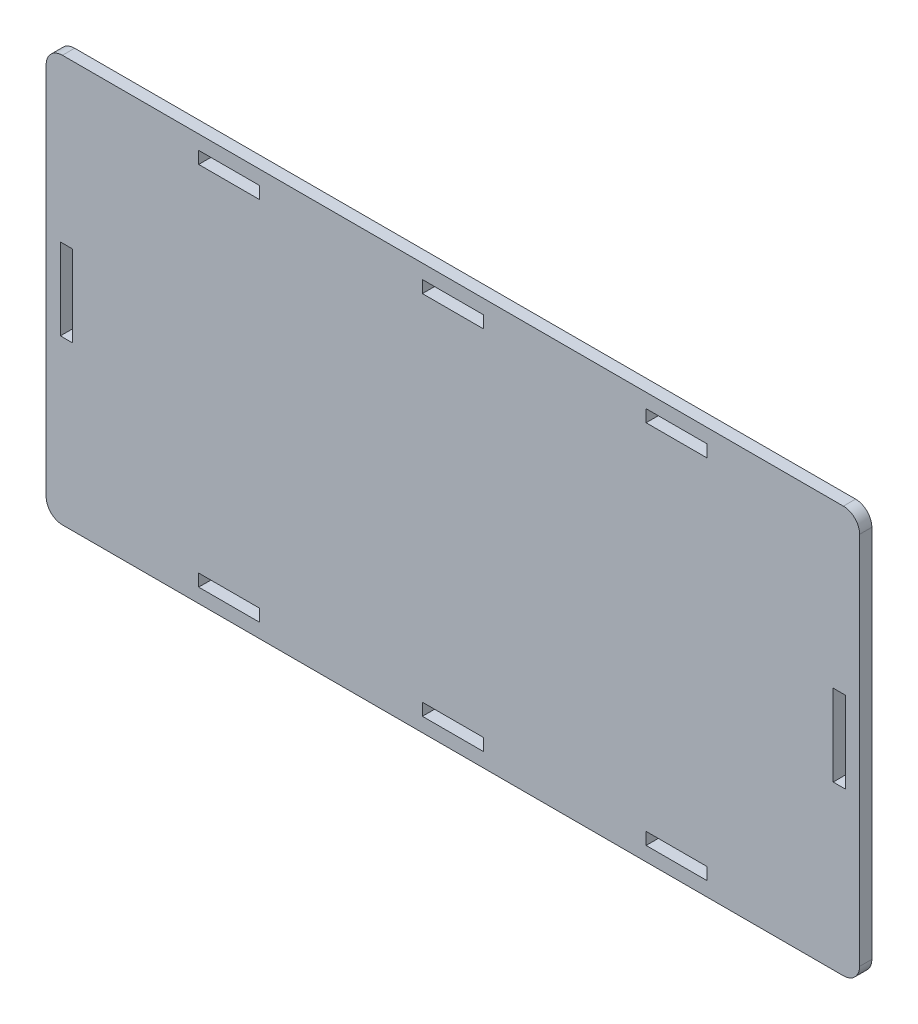
from build123d import *

# Parameters (mm, degrees)
BOSS_EXTRUDE2_DEPTH = 3
SKETCH3_W           = 15
SKETCH3_H           = 3
SKETCH3_W_2         = 3
SKETCH3_H_2         = 20
CUT_EXTRUDE1_DEPTH  = 3


with BuildPart() as part:
    # Sketch1 → Boss-Extrude2 (new body)
    with BuildSketch(Plane.XY):
        with BuildLine():
            Line((-96, 50), (96, 50))
            ThreePointArc((96, 50), (98.828427125, 48.828427125), (100, 46))
            Line((100, 46), (100, -46))
            ThreePointArc((100, -46), (98.828427125, -48.828427125), (96, -50))
            Line((96, -50), (-96, -50))
            ThreePointArc((-96, -50), (-98.828427125, -48.828427125), (-100, -46))
            Line((-100, -46), (-100, 46))
            ThreePointArc((-100, 46), (-98.828427125, 48.828427125), (-96, 50))
        make_face()
    extrude(amount=BOSS_EXTRUDE2_DEPTH)

    # Sketch3 → Cut-Extrude1 (cut)
    with BuildSketch(Plane.XY.offset(3)):
        with Locations((-55, 45)):
            Rectangle(SKETCH3_W, SKETCH3_H)
        with Locations((55, 45)):
            Rectangle(SKETCH3_W, SKETCH3_H)
        with Locations((0, 45)):
            Rectangle(SKETCH3_W, SKETCH3_H)
        with Locations((-95, 0)):
            Rectangle(SKETCH3_W_2, SKETCH3_H_2)
        with Locations((-55, -45)):
            Rectangle(SKETCH3_W, SKETCH3_H)
        with Locations((0, -45)):
            Rectangle(SKETCH3_W, SKETCH3_H)
        with Locations((55, -45)):
            Rectangle(SKETCH3_W, SKETCH3_H)
        with Locations((95, 0)):
            Rectangle(SKETCH3_W_2, SKETCH3_H_2)
    extrude(amount=-CUT_EXTRUDE1_DEPTH, mode=Mode.SUBTRACT)


solid = part.part
